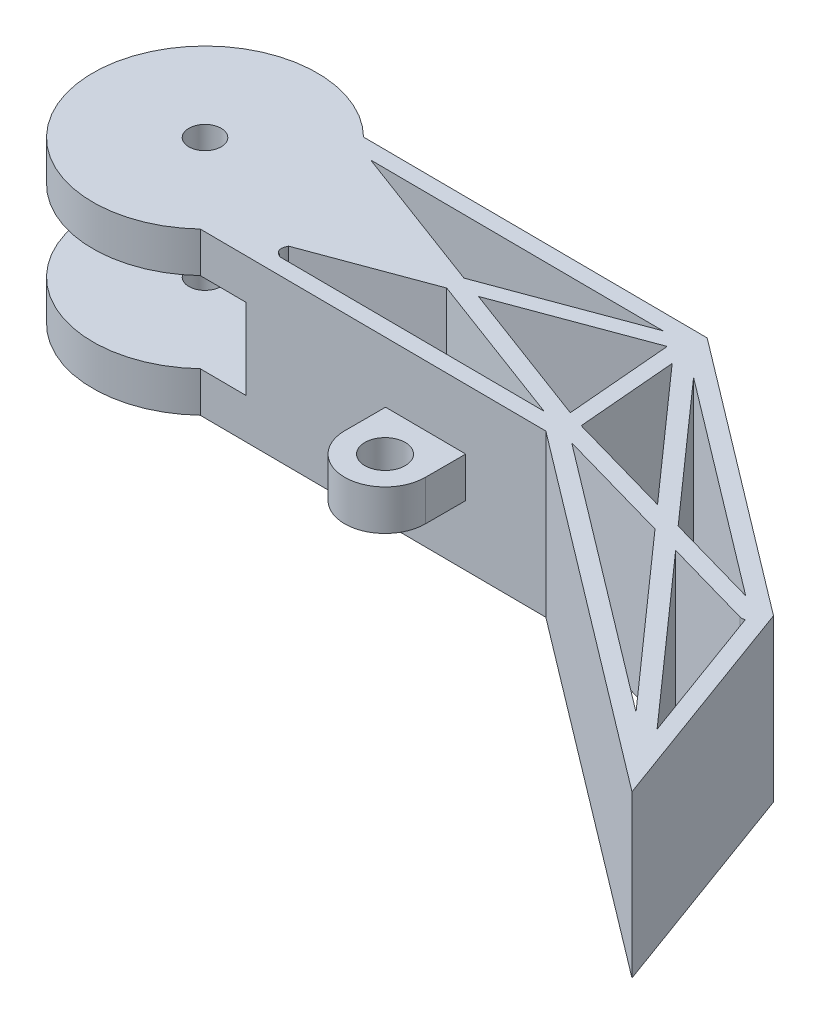
from build123d import *

# Parameters (mm, degrees)
SKETCH2_R                = 2.54
BOSS_EXTRUDE4_DEPTH      = 12.7
CUT_EXTRUDE1_START       = -6.35
SKETCH4_R                = 17.653445752
CUT_EXTRUDE1_DEPTH       = 6.35
CUT_EXTRUDE2_DEPTH       = 6.35
CUT_EXTRUDE5_DEPTH       = 110.404841344
BOSS_EXTRUDE6_DEPTH      = 3.175
BOSS_EXTRUDE6_DEPTH_BACK = 3.175
SKETCH9_R                = 1.5875
BOSS_EXTRUDE7_DEPTH      = 3.175
BOSS_EXTRUDE7_DEPTH_BACK = 3.175
SKETCH10_R               = 3.175


with BuildPart() as part:
    # Sketch2 → Boss-Extrude4 (new body)
    with BuildSketch(Plane(origin=(0, 0, 0), x_dir=(1, 0, 0), z_dir=(0, 1, 0))):
        with BuildLine():
            Line((-2.389959661, -19.009464368), (53.576897676, -61.415787029))
            Line((53.576897676, -61.415787029), (40.725407569, -26.278144211))
            Line((40.725407569, -26.278144211), (-2.389947096, 6.390540945))
            Line((-2.389947096, 6.390540945), (-56.832889033, 6.728052684))
            ThreePointArc((-56.832889033, 6.728052684), (-86.902968212, -5.601105462), (-57.146932766, -18.670005835))
            Line((-57.146932766, -18.670005835), (-2.389959661, -19.009464368))
        make_face()
        with Locations((-69.250871823, -5.819371368)):
            Circle(SKETCH2_R, mode=Mode.SUBTRACT)
    boss_extrude4 = extrude(amount=BOSS_EXTRUDE4_DEPTH)

    # Sketch4 → Cut-Extrude1 (cut)
    with BuildSketch(Plane(origin=(0, 12.7, 0), x_dir=(1, 0, 0), z_dir=(0, 1, 0)).offset(CUT_EXTRUDE1_START)):
        with Locations((-69.250871823, -5.819371368)):
            Circle(SKETCH4_R)
    cut_extrude1 = extrude(amount=CUT_EXTRUDE1_DEPTH, mode=Mode.SUBTRACT)

    # Triangleout → Cut-Extrude2 (cut)
    with BuildSketch(Plane(origin=(0, 6.35, 0), x_dir=(1, 0, 0), z_dir=(0, 1, 0))):
        Polygon((-58.106305107, -19.510345754), (-49.455352435, -19.510345754), (-53.093861055, -12.932398146), align=None)
    cut_extrude2 = extrude(amount=CUT_EXTRUDE2_DEPTH, mode=Mode.SUBTRACT)

    # Mirror3: Boss-Extrude4, Cut-Extrude1, Cut-Extrude2 across plane
    add(boss_extrude4.mirror(Plane(origin=(-69.250871823, 12.7, 5.819371368), x_dir=(0, 0, 1), z_dir=(0, -1, 0))))
    add(cut_extrude1.mirror(Plane(origin=(-69.250871823, 12.7, 5.819371368), x_dir=(0, 0, 1), z_dir=(0, -1, 0))), mode=Mode.SUBTRACT)
    add(cut_extrude2.mirror(Plane(origin=(-69.250871823, 12.7, 5.819371368), x_dir=(0, 0, 1), z_dir=(0, -1, 0))), mode=Mode.SUBTRACT)

    # Sketch5 → Cut-Extrude5 (cut, through all)
    with BuildSketch(Plane(origin=(0, 25.4, 0), x_dir=(1, 0, 0), z_dir=(0, 1, 0))):
        with BuildLine():
            Line((24.097552071, -25.06091259), (47.032009387, -50.915826592))
            Line((47.032009387, -50.915826592), (39.032631765, -29.044489394))
            ThreePointArc((39.032631765, -29.044489394), (38.643597603, -29.120884868), (38.249963383, -29.073599049))
            Line((38.249963383, -29.073599049), (24.097552071, -25.06091259))
        make_face()
        Polygon((1.254561033, -18.584153344), (43.045488894, -50.249314753), (19.561377266, -23.77475387), align=None)
        Polygon((-0.3379923, -15.492487006), (16.432547543, -20.247501304), (-1.662395371, 0.151638142), align=None)
        Polygon((1.927077573, -0.06726641), (20.968722347, -21.533660024), (35.812455727, -25.742359631), align=None)
        with BuildLine():
            Line((-47.082485141, -16.192350224), (-5.220163799, -16.451870087))
            Line((-5.220163799, -16.451870087), (-29.698073475, -7.308879759))
            Line((-29.698073475, -7.308879759), (-47.859799508, -14.045584924))
            add(Edge.make_bspline(
                [(-47.082485141, -16.192350224), (-48.634360584, -15.509518544), (-47.859799508, -14.045584924)],
                knots=[0, 0, 0, 1, 1, 1], degree=2))
        make_face()
        Polygon((-26.055910605, -5.957897073), (-2.964059544, -14.583166702), (-4.375083602, 2.08414359), align=None)
        Polygon((-29.694989168, -4.598628224), (-6.842288937, 3.878093835), (-53.157849902, 4.165220962), align=None)
    extrude(amount=-CUT_EXTRUDE5_DEPTH, mode=Mode.SUBTRACT)

    # Sketch10 → Boss-Extrude7 (add, two sides: drawn at the far end of the back side and taken through both)
    with BuildSketch(Plane.XZ.offset(-12.7).offset(-BOSS_EXTRUDE7_DEPTH_BACK)):
        with BuildLine():
            Line((-27.789959661, 18.852000464), (-15.089959661, 18.930732416))
            Line((-15.089959661, 18.930732416), (-15.089959661, 25.280732416))
            ThreePointArc((-15.089959661, 25.280732416), (-21.439959661, 31.630732416), (-27.789959661, 25.280732416))
            Line((-27.789959661, 25.280732416), (-27.789959661, 18.852000464))
        make_face()
        with Locations((-21.439959661, 25.280732416)):
            Circle(SKETCH10_R, mode=Mode.SUBTRACT)
    extrude(amount=BOSS_EXTRUDE7_DEPTH + BOSS_EXTRUDE7_DEPTH_BACK)


with BuildPart() as body_2:
    # Sketch9 → Boss-Extrude6 (new, two sides: drawn at the far end of the back side and taken through both)
    with BuildSketch(Plane.ZY.offset(11.71840569).offset(-BOSS_EXTRUDE6_DEPTH_BACK)):
        with BuildLine():
            Line((-6.728052684, 18.415), (-6.728052684, 6.985))
            add(Edge.make_bspline(
                [(-9.268051871, 9.525), (-7.287420121, 9.239687539), (-6.728052684, 6.985)],
                knots=[0, 0, 0, 1, 1, 1], degree=2))
            ThreePointArc((-9.268051871, 9.525), (-12.443052684, 12.699999593), (-9.268052684, 15.875))
            add(Edge.make_bspline(
                [(-9.268052684, 15.875), (-7.438159142, 16.135664609), (-6.728052684, 18.415)],
                knots=[0, 0, 0, 1, 1, 1], degree=2))
        make_face()
        with Locations((-9.268052684, 12.7)):
            Circle(SKETCH9_R, mode=Mode.SUBTRACT)
    extrude(amount=BOSS_EXTRUDE6_DEPTH + BOSS_EXTRUDE6_DEPTH_BACK)


solid = Compound([part.part, body_2.part])
